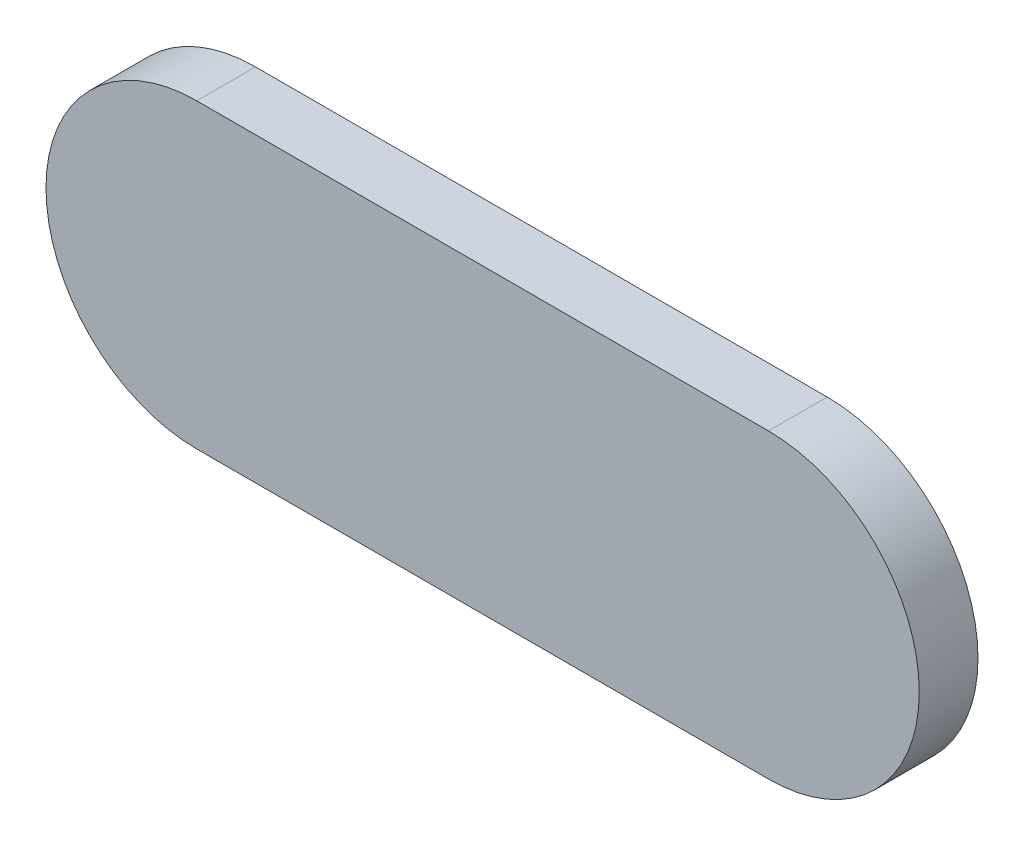
from build123d import *

# Parameters (mm, degrees)
EXTRUDE_1_DEPTH = 1.5
EXTRUDE_2_DEPTH = 0.5
SKETCH_3_R      = 0.75
EXTRUDE_3_DEPTH = 1
FILLET_2_R      = 0.5


with BuildPart() as part:
    # 草图1 → 凸台-拉伸1 (new body)
    with BuildSketch(Plane.XY):
        with BuildLine():
            Line((7.3, 3.85), (-7.3, 3.85))
            ThreePointArc((-7.3, 3.85), (-11.15, 0), (-7.3, -3.85))
            Line((-7.3, -3.85), (7.3, -3.85))
            ThreePointArc((7.3, -3.85), (11.15, 0), (7.3, 3.85))
        make_face()
    extrude(amount=EXTRUDE_1_DEPTH)

    # 草图2 → 凸台-拉伸2 (add)
    with BuildSketch(Plane(origin=(0, 0, 0), x_dir=(-1, 0, 0), z_dir=(0, 0, -1))):
        with BuildLine():
            Line((-7.35, 2.3), (7.35, 2.3))
            ThreePointArc((7.35, 2.3), (9.65, 0), (7.35, -2.3))
            Line((7.35, -2.3), (-7.35, -2.3))
            ThreePointArc((-7.35, -2.3), (-9.65, 0), (-7.35, 2.3))
        make_face()
    extrude(amount=EXTRUDE_2_DEPTH)

    # 草图3 → 凸台-拉伸3 (add)
    with BuildSketch(Plane(origin=(0, 0, -0.5), x_dir=(-1, 0, 0), z_dir=(0, 0, -1))):
        with Locations((1.27, 0)):
            Circle(SKETCH_3_R)
        with Locations((3.81, 0)):
            Circle(SKETCH_3_R)
        with Locations((-3.81, 0)):
            Circle(SKETCH_3_R)
        with Locations((-1.27, 0)):
            Circle(SKETCH_3_R)
    extrude(amount=EXTRUDE_3_DEPTH)

    # 圆角2
    fillet_2_edges = [part.edges().sort_by_distance(p)[0] for p in [
        (4.56, 0, -1.5),
        (-3.06, 0, -1.5),
        (-0.52, 0, -1.5),
        (2.02, 0, -1.5),
    ]]
    fillet(fillet_2_edges, radius=FILLET_2_R)


solid = part.part
